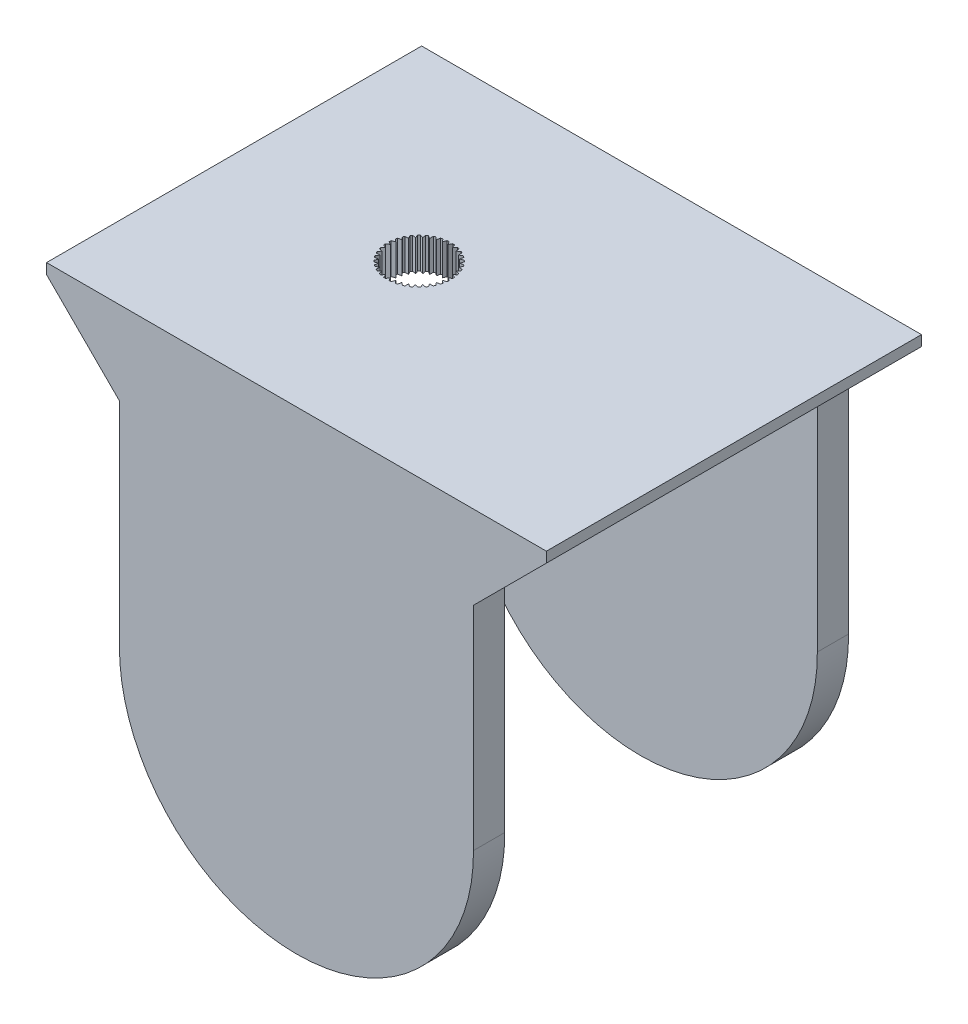
from build123d import *

# Parameters (mm, degrees)
SKETCH1_W           = 48
SKETCH1_H           = 36.02
BOSS_EXTRUDE1_DEPTH = 3
CUT_EXTRUDE1_DEPTH  = 3
SKETCH4_W           = 36.02
SKETCH4_H           = 3
BOSS_EXTRUDE3_DEPTH = 6.23
SKETCH5_W           = 36.02
SKETCH5_H           = 3
CUT_EXTRUDE2_DEPTH  = 6.23
SKETCH6_W           = 34
SKETCH6_H           = 3
BOSS_EXTRUDE4_DEPTH = 25.4
BOSS_EXTRUDE5_DEPTH = 3
CHAMFER1_SIZE       = 5
CHAMFER2_SIZE       = 5
BOSS_EXTRUDE6_DEPTH = 3
CHAMFER3_SIZE       = 5
CHAMFER4_SIZE       = 2
CHAMFER5_SIZE       = 2


with BuildPart() as part:
    # Sketch1 → Boss-Extrude1 (new body)
    with BuildSketch(Plane(origin=(0, 0, 0), x_dir=(1, 0, 0), z_dir=(0, 1, 0))):
        Rectangle(SKETCH1_W, SKETCH1_H)
    extrude(amount=BOSS_EXTRUDE1_DEPTH)

    # Sketch2 → Cut-Extrude1 (cut)
    with BuildSketch(Plane(origin=(0, 3, 0), x_dir=(1, 0, 0), z_dir=(0, 1, 0))):
        with BuildLine():
            Line((2.458448267, 1.491170008), (2.504760174, 1.571384585))
            Line((2.504760174, 1.571384585), (2.56843672, 1.681675597))
            ThreePointArc((2.56843672, 1.681675597), (2.514796776, 1.76087966), (2.458715244, 1.838374104))
            Line((2.458715244, 1.838374104), (2.333296932, 1.816259472))
            Line((2.333296932, 1.816259472), (2.242080281, 1.800175515))
            Line((2.242080281, 1.800175515), (2.119635244, 1.778585151))
            Line((2.119635244, 1.778585151), (2.162159959, 1.895420846))
            Line((2.162159959, 1.895420846), (2.19383917, 1.982458762))
            Line((2.19383917, 1.982458762), (2.237396492, 2.102131522))
            ThreePointArc((2.237396492, 2.102131522), (2.170817818, 2.170817818), (2.102131522, 2.237396492))
            Line((2.102131522, 2.237396492), (1.982458762, 2.19383917))
            Line((1.982458762, 2.19383917), (1.895420846, 2.162159959))
            Line((1.895420846, 2.162159959), (1.778585151, 2.119635244))
            Line((1.778585151, 2.119635244), (1.800175515, 2.242080281))
            Line((1.800175515, 2.242080281), (1.816259472, 2.333296932))
            Line((1.816259472, 2.333296932), (1.838374104, 2.458715244))
            ThreePointArc((1.838374104, 2.458715244), (1.76087966, 2.514796776), (1.681675597, 2.56843672))
            Line((1.681675597, 2.56843672), (1.571384585, 2.504760174))
            Line((1.571384585, 2.504760174), (1.491170008, 2.458448267))
            Line((1.491170008, 2.458448267), (1.383493649, 2.396281292))
            Line((1.383493649, 2.396281292), (1.383493649, 2.520615242))
            Line((1.383493649, 2.520615242), (1.383493649, 2.613239056))
            Line((1.383493649, 2.613239056), (1.383493649, 2.740592148))
            ThreePointArc((1.383493649, 2.740592148), (1.297438064, 2.782364906), (1.21012281, 2.821436298))
            Line((1.21012281, 2.821436298), (1.112564682, 2.739575309))
            Line((1.112564682, 2.739575309), (1.041610723, 2.680037868))
            Line((1.041610723, 2.680037868), (0.946365392, 2.600117546))
            Line((0.946365392, 2.600117546), (0.924775029, 2.722562583))
            Line((0.924775029, 2.722562583), (0.908691072, 2.813779234))
            Line((0.908691072, 2.813779234), (0.88657644, 2.939197546))
            ThreePointArc((0.88657644, 2.939197546), (0.794574468, 2.965392287), (0.701801054, 2.988707962))
            Line((0.701801054, 2.988707962), (0.619940065, 2.891149833))
            Line((0.619940065, 2.891149833), (0.560402624, 2.820195875))
            Line((0.560402624, 2.820195875), (0.480482302, 2.724950544))
            Line((0.480482302, 2.724950544), (0.437957587, 2.841786239))
            Line((0.437957587, 2.841786239), (0.406278376, 2.928824154))
            Line((0.406278376, 2.928824154), (0.362721054, 3.048496914))
            ThreePointArc((0.362721054, 3.048496914), (0.26756813, 3.058317723), (0.172155428, 3.065169246))
            Line((0.172155428, 3.065169246), (0.108478882, 2.954878234))
            Line((0.108478882, 2.954878234), (0.062166975, 2.874663657))
            Line((0.062166975, 2.874663657), (0, 2.766987298))
            Line((0, 2.766987298), (-0.062166975, 2.874663657))
            Line((-0.062166975, 2.874663657), (-0.108478882, 2.954878234))
            Line((-0.108478882, 2.954878234), (-0.172155428, 3.065169246))
            ThreePointArc((-0.172155428, 3.065169246), (-0.26756813, 3.058317723), (-0.362721054, 3.048496914))
            Line((-0.362721054, 3.048496914), (-0.406278376, 2.928824154))
            Line((-0.406278376, 2.928824154), (-0.437957587, 2.841786239))
            Line((-0.437957587, 2.841786239), (-0.480482302, 2.724950544))
            Line((-0.480482302, 2.724950544), (-0.560402624, 2.820195875))
            Line((-0.560402624, 2.820195875), (-0.619940065, 2.891149833))
            Line((-0.619940065, 2.891149833), (-0.701801054, 2.988707962))
            ThreePointArc((-0.701801054, 2.988707962), (-0.794574468, 2.965392287), (-0.88657644, 2.939197546))
            Line((-0.88657644, 2.939197546), (-0.908691072, 2.813779234))
            Line((-0.908691072, 2.813779234), (-0.924775029, 2.722562583))
            Line((-0.924775029, 2.722562583), (-0.946365392, 2.600117546))
            Line((-0.946365392, 2.600117546), (-1.041610723, 2.680037868))
            Line((-1.041610723, 2.680037868), (-1.112564682, 2.739575309))
            Line((-1.112564682, 2.739575309), (-1.21012281, 2.821436298))
            ThreePointArc((-1.21012281, 2.821436298), (-1.297438064, 2.782364906), (-1.383493649, 2.740592148))
            Line((-1.383493649, 2.740592148), (-1.383493649, 2.613239056))
            Line((-1.383493649, 2.613239056), (-1.383493649, 2.520615242))
            Line((-1.383493649, 2.520615242), (-1.383493649, 2.396281292))
            Line((-1.383493649, 2.396281292), (-1.491170008, 2.458448267))
            Line((-1.491170008, 2.458448267), (-1.571384585, 2.504760174))
            Line((-1.571384585, 2.504760174), (-1.681675597, 2.56843672))
            ThreePointArc((-1.681675597, 2.56843672), (-1.76087966, 2.514796776), (-1.838374104, 2.458715244))
            Line((-1.838374104, 2.458715244), (-1.816259472, 2.333296932))
            Line((-1.816259472, 2.333296932), (-1.800175515, 2.242080281))
            Line((-1.800175515, 2.242080281), (-1.778585151, 2.119635244))
            Line((-1.778585151, 2.119635244), (-1.895420846, 2.162159959))
            Line((-1.895420846, 2.162159959), (-1.982458762, 2.19383917))
            Line((-1.982458762, 2.19383917), (-2.102131522, 2.237396492))
            ThreePointArc((-2.102131522, 2.237396492), (-2.170817818, 2.170817818), (-2.237396492, 2.102131522))
            Line((-2.237396492, 2.102131522), (-2.19383917, 1.982458762))
            Line((-2.19383917, 1.982458762), (-2.162159959, 1.895420846))
            Line((-2.162159959, 1.895420846), (-2.119635244, 1.778585151))
            Line((-2.119635244, 1.778585151), (-2.242080281, 1.800175515))
            Line((-2.242080281, 1.800175515), (-2.333296932, 1.816259472))
            Line((-2.333296932, 1.816259472), (-2.458715244, 1.838374104))
            ThreePointArc((-2.458715244, 1.838374104), (-2.514796776, 1.76087966), (-2.56843672, 1.681675597))
            Line((-2.56843672, 1.681675597), (-2.504760174, 1.571384585))
            Line((-2.504760174, 1.571384585), (-2.458448267, 1.491170008))
            Line((-2.458448267, 1.491170008), (-2.396281292, 1.383493649))
            Line((-2.396281292, 1.383493649), (-2.520615242, 1.383493649))
            Line((-2.520615242, 1.383493649), (-2.613239056, 1.383493649))
            Line((-2.613239056, 1.383493649), (-2.740592148, 1.383493649))
            ThreePointArc((-2.740592148, 1.383493649), (-2.782364906, 1.297438064), (-2.821436298, 1.21012281))
            Line((-2.821436298, 1.21012281), (-2.739575309, 1.112564682))
            Line((-2.739575309, 1.112564682), (-2.680037868, 1.041610723))
            Line((-2.680037868, 1.041610723), (-2.600117546, 0.946365392))
            Line((-2.600117546, 0.946365392), (-2.722562583, 0.924775029))
            Line((-2.722562583, 0.924775029), (-2.813779234, 0.908691072))
            Line((-2.813779234, 0.908691072), (-2.939197546, 0.88657644))
            ThreePointArc((-2.939197546, 0.88657644), (-2.965392287, 0.794574468), (-2.988707962, 0.701801054))
            Line((-2.988707962, 0.701801054), (-2.891149833, 0.619940065))
            Line((-2.891149833, 0.619940065), (-2.820195875, 0.560402624))
            Line((-2.820195875, 0.560402624), (-2.724950544, 0.480482302))
            Line((-2.724950544, 0.480482302), (-2.841786239, 0.437957587))
            Line((-2.841786239, 0.437957587), (-2.928824154, 0.406278376))
            Line((-2.928824154, 0.406278376), (-3.048496914, 0.362721054))
            ThreePointArc((-3.048496914, 0.362721054), (-3.058317723, 0.26756813), (-3.065169246, 0.172155428))
            Line((-3.065169246, 0.172155428), (-2.954878234, 0.108478882))
            Line((-2.954878234, 0.108478882), (-2.874663657, 0.062166975))
            Line((-2.874663657, 0.062166975), (-2.766987298, 0))
            Line((-2.766987298, 0), (-2.874663657, -0.062166975))
            Line((-2.874663657, -0.062166975), (-2.954878234, -0.108478882))
            Line((-2.954878234, -0.108478882), (-3.065169246, -0.172155428))
            ThreePointArc((-3.065169246, -0.172155428), (-3.058317723, -0.26756813), (-3.048496914, -0.362721054))
            Line((-3.048496914, -0.362721054), (-2.928824154, -0.406278376))
            Line((-2.928824154, -0.406278376), (-2.841786239, -0.437957587))
            Line((-2.841786239, -0.437957587), (-2.724950544, -0.480482302))
            Line((-2.724950544, -0.480482302), (-2.820195875, -0.560402624))
            Line((-2.820195875, -0.560402624), (-2.891149833, -0.619940065))
            Line((-2.891149833, -0.619940065), (-2.988707962, -0.701801054))
            ThreePointArc((-2.988707962, -0.701801054), (-2.965392287, -0.794574468), (-2.939197546, -0.88657644))
            Line((-2.939197546, -0.88657644), (-2.813779234, -0.908691072))
            Line((-2.813779234, -0.908691072), (-2.722562583, -0.924775029))
            Line((-2.722562583, -0.924775029), (-2.600117546, -0.946365392))
            Line((-2.600117546, -0.946365392), (-2.680037868, -1.041610723))
            Line((-2.680037868, -1.041610723), (-2.739575309, -1.112564682))
            Line((-2.739575309, -1.112564682), (-2.821436298, -1.21012281))
            ThreePointArc((-2.821436298, -1.21012281), (-2.782364906, -1.297438064), (-2.740592148, -1.383493649))
            Line((-2.740592148, -1.383493649), (-2.613239056, -1.383493649))
            Line((-2.613239056, -1.383493649), (-2.520615242, -1.383493649))
            Line((-2.520615242, -1.383493649), (-2.396281292, -1.383493649))
            Line((-2.396281292, -1.383493649), (-2.458448267, -1.491170008))
            Line((-2.458448267, -1.491170008), (-2.504760174, -1.571384585))
            Line((-2.504760174, -1.571384585), (-2.56843672, -1.681675597))
            ThreePointArc((-2.56843672, -1.681675597), (-2.514796776, -1.76087966), (-2.458715244, -1.838374104))
            Line((-2.458715244, -1.838374104), (-2.333296932, -1.816259472))
            Line((-2.333296932, -1.816259472), (-2.242080281, -1.800175515))
            Line((-2.242080281, -1.800175515), (-2.119635244, -1.778585151))
            Line((-2.119635244, -1.778585151), (-2.162159959, -1.895420846))
            Line((-2.162159959, -1.895420846), (-2.19383917, -1.982458762))
            Line((-2.19383917, -1.982458762), (-2.237396492, -2.102131522))
            ThreePointArc((-2.237396492, -2.102131522), (-2.170817818, -2.170817818), (-2.102131522, -2.237396492))
            Line((-2.102131522, -2.237396492), (-1.982458762, -2.19383917))
            Line((-1.982458762, -2.19383917), (-1.895420846, -2.162159959))
            Line((-1.895420846, -2.162159959), (-1.778585151, -2.119635244))
            Line((-1.778585151, -2.119635244), (-1.800175515, -2.242080281))
            Line((-1.800175515, -2.242080281), (-1.816259472, -2.333296932))
            Line((-1.816259472, -2.333296932), (-1.838374104, -2.458715244))
            ThreePointArc((-1.838374104, -2.458715244), (-1.76087966, -2.514796776), (-1.681675597, -2.56843672))
            Line((-1.681675597, -2.56843672), (-1.571384585, -2.504760174))
            Line((-1.571384585, -2.504760174), (-1.491170008, -2.458448267))
            Line((-1.491170008, -2.458448267), (-1.383493649, -2.396281292))
            Line((-1.383493649, -2.396281292), (-1.383493649, -2.520615242))
            Line((-1.383493649, -2.520615242), (-1.383493649, -2.613239056))
            Line((-1.383493649, -2.613239056), (-1.383493649, -2.740592148))
            ThreePointArc((-1.383493649, -2.740592148), (-1.297438064, -2.782364906), (-1.21012281, -2.821436298))
            Line((-1.21012281, -2.821436298), (-1.112564682, -2.739575309))
            Line((-1.112564682, -2.739575309), (-1.041610723, -2.680037868))
            Line((-1.041610723, -2.680037868), (-0.946365392, -2.600117546))
            Line((-0.946365392, -2.600117546), (-0.924775029, -2.722562583))
            Line((-0.924775029, -2.722562583), (-0.908691072, -2.813779234))
            Line((-0.908691072, -2.813779234), (-0.88657644, -2.939197546))
            ThreePointArc((-0.88657644, -2.939197546), (-0.794574468, -2.965392287), (-0.701801054, -2.988707962))
            Line((-0.701801054, -2.988707962), (-0.619940065, -2.891149833))
            Line((-0.619940065, -2.891149833), (-0.560402624, -2.820195875))
            Line((-0.560402624, -2.820195875), (-0.480482302, -2.724950544))
            Line((-0.480482302, -2.724950544), (-0.437957587, -2.841786239))
            Line((-0.437957587, -2.841786239), (-0.406278376, -2.928824154))
            Line((-0.406278376, -2.928824154), (-0.362721054, -3.048496914))
            ThreePointArc((-0.362721054, -3.048496914), (-0.26756813, -3.058317723), (-0.172155428, -3.065169246))
            Line((-0.172155428, -3.065169246), (-0.108478882, -2.954878234))
            Line((-0.108478882, -2.954878234), (-0.062166975, -2.874663657))
            Line((-0.062166975, -2.874663657), (0, -2.766987298))
            Line((0, -2.766987298), (0.062166975, -2.874663657))
            Line((0.062166975, -2.874663657), (0.108478882, -2.954878234))
            Line((0.108478882, -2.954878234), (0.172155428, -3.065169246))
            ThreePointArc((0.172155428, -3.065169246), (0.26756813, -3.058317723), (0.362721054, -3.048496914))
            Line((0.362721054, -3.048496914), (0.406278376, -2.928824154))
            Line((0.406278376, -2.928824154), (0.437957587, -2.841786239))
            Line((0.437957587, -2.841786239), (0.480482302, -2.724950544))
            Line((0.480482302, -2.724950544), (0.560402624, -2.820195875))
            Line((0.560402624, -2.820195875), (0.619940065, -2.891149833))
            Line((0.619940065, -2.891149833), (0.701801054, -2.988707962))
            ThreePointArc((0.701801054, -2.988707962), (0.794574468, -2.965392287), (0.88657644, -2.939197546))
            Line((0.88657644, -2.939197546), (0.908691072, -2.813779234))
            Line((0.908691072, -2.813779234), (0.924775029, -2.722562583))
            Line((0.924775029, -2.722562583), (0.946365392, -2.600117546))
            Line((0.946365392, -2.600117546), (1.041610723, -2.680037868))
            Line((1.041610723, -2.680037868), (1.112564682, -2.739575309))
            Line((1.112564682, -2.739575309), (1.21012281, -2.821436298))
            ThreePointArc((1.21012281, -2.821436298), (1.297438064, -2.782364906), (1.383493649, -2.740592148))
            Line((1.383493649, -2.740592148), (1.383493649, -2.613239056))
            Line((1.383493649, -2.613239056), (1.383493649, -2.520615242))
            Line((1.383493649, -2.520615242), (1.383493649, -2.396281292))
            Line((1.383493649, -2.396281292), (1.491170008, -2.458448267))
            Line((1.491170008, -2.458448267), (1.571384585, -2.504760174))
            Line((1.571384585, -2.504760174), (1.681675597, -2.56843672))
            ThreePointArc((1.681675597, -2.56843672), (1.76087966, -2.514796776), (1.838374104, -2.458715244))
            Line((1.838374104, -2.458715244), (1.816259472, -2.333296932))
            Line((1.816259472, -2.333296932), (1.800175515, -2.242080281))
            Line((1.800175515, -2.242080281), (1.778585151, -2.119635244))
            Line((1.778585151, -2.119635244), (1.895420846, -2.162159959))
            Line((1.895420846, -2.162159959), (1.982458762, -2.19383917))
            Line((1.982458762, -2.19383917), (2.102131522, -2.237396492))
            ThreePointArc((2.102131522, -2.237396492), (2.170817818, -2.170817818), (2.237396492, -2.102131522))
            Line((2.237396492, -2.102131522), (2.19383917, -1.982458762))
            Line((2.19383917, -1.982458762), (2.162159959, -1.895420846))
            Line((2.162159959, -1.895420846), (2.119635244, -1.778585151))
            Line((2.119635244, -1.778585151), (2.242080281, -1.800175515))
            Line((2.242080281, -1.800175515), (2.333296932, -1.816259472))
            Line((2.333296932, -1.816259472), (2.458715244, -1.838374104))
            ThreePointArc((2.458715244, -1.838374104), (2.514796776, -1.76087966), (2.56843672, -1.681675597))
            Line((2.56843672, -1.681675597), (2.504760174, -1.571384585))
            Line((2.504760174, -1.571384585), (2.458448267, -1.491170008))
            Line((2.458448267, -1.491170008), (2.396281292, -1.383493649))
            Line((2.396281292, -1.383493649), (2.520615242, -1.383493649))
            Line((2.520615242, -1.383493649), (2.613239056, -1.383493649))
            Line((2.613239056, -1.383493649), (2.740592148, -1.383493649))
            ThreePointArc((2.740592148, -1.383493649), (2.782364906, -1.297438064), (2.821436298, -1.21012281))
            Line((2.821436298, -1.21012281), (2.739575309, -1.112564682))
            Line((2.739575309, -1.112564682), (2.680037868, -1.041610723))
            Line((2.680037868, -1.041610723), (2.600117546, -0.946365392))
            Line((2.600117546, -0.946365392), (2.722562583, -0.924775029))
            Line((2.722562583, -0.924775029), (2.813779234, -0.908691072))
            Line((2.813779234, -0.908691072), (2.939197546, -0.88657644))
            ThreePointArc((2.939197546, -0.88657644), (2.965392287, -0.794574468), (2.988707962, -0.701801054))
            Line((2.988707962, -0.701801054), (2.891149833, -0.619940065))
            Line((2.891149833, -0.619940065), (2.820195875, -0.560402624))
            Line((2.820195875, -0.560402624), (2.724950544, -0.480482302))
            Line((2.724950544, -0.480482302), (2.841786239, -0.437957587))
            Line((2.841786239, -0.437957587), (2.928824154, -0.406278376))
            Line((2.928824154, -0.406278376), (3.048496914, -0.362721054))
            ThreePointArc((3.048496914, -0.362721054), (3.058317723, -0.26756813), (3.065169246, -0.172155428))
            Line((3.065169246, -0.172155428), (2.954878234, -0.108478882))
            Line((2.954878234, -0.108478882), (2.874663657, -0.062166975))
            Line((2.874663657, -0.062166975), (2.766987298, 0))
            Line((2.766987298, 0), (2.874663657, 0.062166975))
            Line((2.874663657, 0.062166975), (2.954878234, 0.108478882))
            Line((2.954878234, 0.108478882), (3.065169246, 0.172155428))
            ThreePointArc((3.065169246, 0.172155428), (3.058317723, 0.26756813), (3.048496914, 0.362721054))
            Line((3.048496914, 0.362721054), (2.928824154, 0.406278376))
            Line((2.928824154, 0.406278376), (2.841786239, 0.437957587))
            Line((2.841786239, 0.437957587), (2.724950544, 0.480482302))
            Line((2.724950544, 0.480482302), (2.820195875, 0.560402624))
            Line((2.820195875, 0.560402624), (2.891149833, 0.619940065))
            Line((2.891149833, 0.619940065), (2.988707962, 0.701801054))
            ThreePointArc((2.988707962, 0.701801054), (2.965392287, 0.794574468), (2.939197546, 0.88657644))
            Line((2.939197546, 0.88657644), (2.813779234, 0.908691072))
            Line((2.813779234, 0.908691072), (2.722562583, 0.924775029))
            Line((2.722562583, 0.924775029), (2.600117546, 0.946365392))
            Line((2.600117546, 0.946365392), (2.680037868, 1.041610723))
            Line((2.680037868, 1.041610723), (2.739575309, 1.112564682))
            Line((2.739575309, 1.112564682), (2.821436298, 1.21012281))
            ThreePointArc((2.821436298, 1.21012281), (2.782364906, 1.297438064), (2.740592148, 1.383493649))
            Line((2.740592148, 1.383493649), (2.613239056, 1.383493649))
            Line((2.613239056, 1.383493649), (2.520615242, 1.383493649))
            Line((2.520615242, 1.383493649), (2.396281292, 1.383493649))
            Line((2.396281292, 1.383493649), (2.458448267, 1.491170008))
        make_face()
    extrude(amount=-CUT_EXTRUDE1_DEPTH, mode=Mode.SUBTRACT)

    # Sketch4 → Boss-Extrude3 (add)
    with BuildSketch(Plane(origin=(24, 0, 0), x_dir=(0, 0, -1), z_dir=(1, 0, 0))):
        with Locations((0, 1.5)):
            Rectangle(SKETCH4_W, SKETCH4_H)
    extrude(amount=BOSS_EXTRUDE3_DEPTH)

    # Sketch5 → Cut-Extrude2 (cut)
    with BuildSketch(Plane.ZY.offset(24)):
        with Locations((0, 1.5)):
            Rectangle(SKETCH5_W, SKETCH5_H)
    extrude(amount=-CUT_EXTRUDE2_DEPTH, mode=Mode.SUBTRACT)

    # Sketch6 → Boss-Extrude4 (add)
    with BuildSketch(Plane.XZ):
        with Locations((6.23, 16.51)):
            Rectangle(SKETCH6_W, SKETCH6_H)
        with Locations((6.23, -16.51)):
            Rectangle(SKETCH6_W, SKETCH6_H)
    extrude(amount=BOSS_EXTRUDE4_DEPTH)

    # Sketch7 → Boss-Extrude5 (add)
    with BuildSketch(Plane.XY.offset(18.01)):
        with BuildLine():
            Line((-10.77, -25.4), (23.23, -25.4))
            ThreePointArc((23.23, -25.4), (6.23, -42.503896996), (-10.77, -25.4))
        make_face()
    extrude(amount=-BOSS_EXTRUDE5_DEPTH)

    # Chamfer1
    chamfer1_edges = [part.edges().sort_by_distance(p)[0] for p in [
        (23.23, 0, 16.51),
    ]]
    chamfer(chamfer1_edges, length=CHAMFER1_SIZE)

    # Chamfer2
    chamfer2_edges = [part.edges().sort_by_distance(p)[0] for p in [
        (-10.77, 0, 16.51),
    ]]
    chamfer(chamfer2_edges, length=CHAMFER2_SIZE)

    # Sketch8 → Boss-Extrude6 (add)
    with BuildSketch(Plane(origin=(0, 0, -18.01), x_dir=(-1, 0, 0), z_dir=(0, 0, -1))):
        with BuildLine():
            Line((10.77, -25.4), (-23.23, -25.4))
            ThreePointArc((-23.23, -25.4), (-6.23, -42.505960793), (10.77, -25.4))
        make_face()
    extrude(amount=-BOSS_EXTRUDE6_DEPTH)

    # Chamfer3
    chamfer3_edges = [part.edges().sort_by_distance(p)[0] for p in [
        (-10.77, 0, -16.51),
        (23.23, 0, -16.51),
    ]]
    chamfer(chamfer3_edges, length=CHAMFER3_SIZE)

    # Chamfer4
    chamfer4_edges = [part.edges().sort_by_distance(p)[0] for p in [
        (-17.77, 0, 0),
    ]]
    chamfer(chamfer4_edges, length=CHAMFER4_SIZE - 0.0001)  # a hair under: the kernel refuses the full size

    # Chamfer5
    chamfer5_edges = [part.edges().sort_by_distance(p)[0] for p in [
        (30.23, 0, 0),
    ]]
    chamfer(chamfer5_edges, length=CHAMFER5_SIZE - 0.0001)  # a hair under: the kernel refuses the full size


solid = part.part
